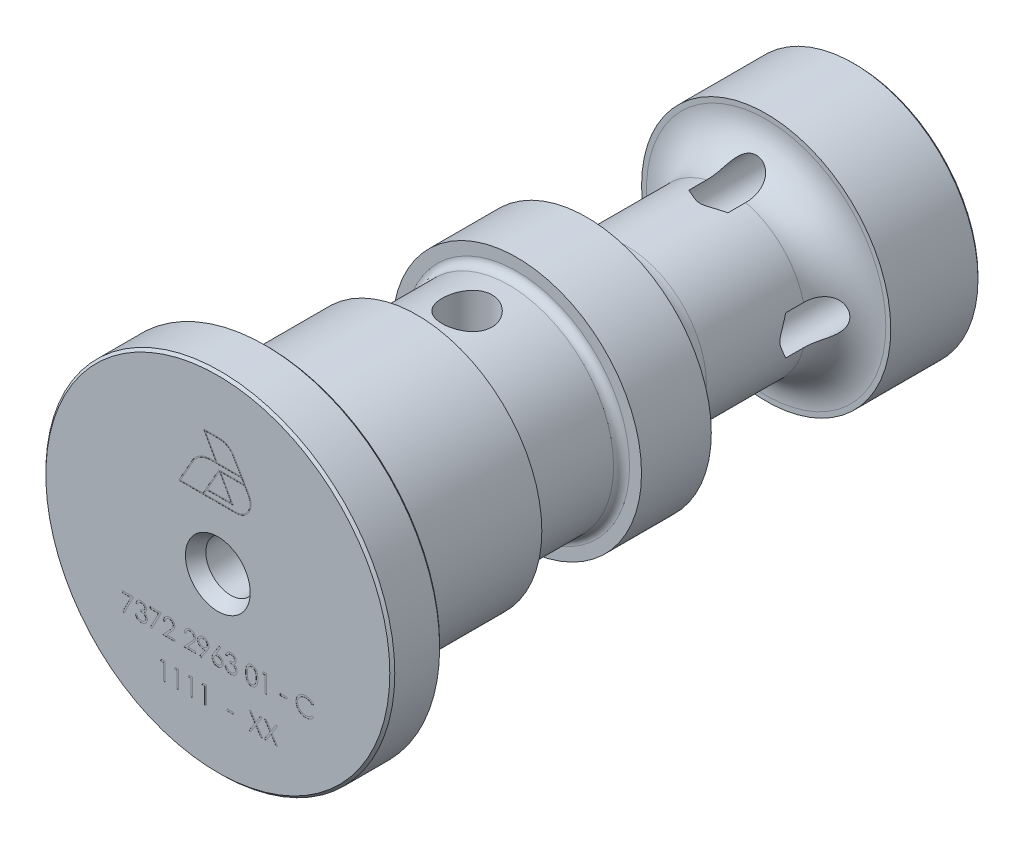
from build123d import *

# Parameters (mm, degrees)
CIRPATTERN1_COUNT       = 4
CUT_EXTRUDE2_DEPTH      = 69.618510622
CUT_EXTRUDE2_DEPTH_BACK = 69.618510622
SKETCH4_R               = 2.5
SKETCH5_W               = 0.692307692
SKETCH5_H               = 0.184615385
CUT_EXTRUDE3_DEPTH      = 0.01


with BuildPart() as part:
    # Sketch1 → Revolve1 (revolve)
    with BuildSketch(Plane(origin=(0, 0, 0), x_dir=(0, 0, -1), z_dir=(1, 0, 0))):
        with BuildLine():
            Line((0, 3.25), (0, 17.25))
            Line((0, 17.25), (0.25, 17.5))
            Line((0.25, 17.5), (4.75, 17.5))
            Line((4.75, 17.5), (5, 17.25))
            Line((5, 17.25), (5, 14.4975))
            ThreePointArc((5, 14.4975), (5.585786438, 13.083286438), (7, 12.4975))
            Line((7, 12.4975), (20, 12.4975))
            Line((20, 12.4975), (20, 11.3))
            ThreePointArc((20, 11.3), (20.234314575, 10.734314575), (20.8, 10.5))
            Line((20.8, 10.5), (29.2, 10.5))
            ThreePointArc((29.2, 10.5), (29.765685425, 10.734314575), (30, 11.3))
            Line((30, 11.3), (30, 12.4975))
            Line((30, 12.4975), (37, 12.4975))
            Line((37, 12.4975), (37, 12))
            ThreePointArc((37, 12), (38.171572875, 9.171572875), (41, 8))
            Line((41, 8), (51, 8))
            ThreePointArc((51, 8), (53.828427125, 9.171572875), (55, 12))
            Line((55, 12), (55, 12.4975))
            Line((55, 12.4975), (63.75, 12.4975))
            Line((63.75, 12.4975), (64, 12.2475))
            Line((64, 12.2475), (64, 10))
            Line((64, 10), (63.5, 9.5))
            Line((63.5, 9.5), (60.25, 9.5))
            ThreePointArc((60.25, 9.5), (59.366116524, 9.133883476), (59, 8.25))
            Line((59, 8.25), (59, 4.25))
            Line((59, 4.25), (57.718282402, 3.51))
            Line((57.718282402, 3.51), (33, 3.51))
            Line((33, 3.51), (33, 3.4))
            Line((33, 3.4), (22.042926105, 3.4))
            Line((22.042926105, 3.4), (20, 0))
            Line((20, 0), (11, 0))
            Line((11, 0), (9.497848452, 2.5))
            Line((9.497848452, 2.5), (1.299038106, 2.5))
            Line((1.299038106, 2.5), (0, 3.25))
        make_face()
    revolve(axis=Axis((0, 0, 67.498669623), (0, 0, -1)))

    # Sketch3 → Cut-Revolve3 (revolve, cut)
    with BuildSketch(Plane(origin=(0, 0, 0), x_dir=(0, 0, -1), z_dir=(1, 0, 0))):
        Polygon((66.818419238, -7.375), (66.818419238, -9.375), (49.201721238, -9.375), (48, -7.375), align=None)
    cut_revolve3 = revolve(axis=Axis((0, -7.375, -68.053965544), (0, 0, 1)), mode=Mode.SUBTRACT)

    # CirPattern1: Cut-Revolve3 ×4 about axis
    cirpattern1_axis = Axis((0, 0, -67.2), (0, 0, 1))
    for i in range(1, CIRPATTERN1_COUNT):
        add(cut_revolve3.rotate(cirpattern1_axis, i * 360 / CIRPATTERN1_COUNT), mode=Mode.SUBTRACT)

    # Sketch4 → Cut-Extrude2 (cut, two sides: drawn at the far end of the back side and taken through both)
    with BuildSketch(Plane(origin=(0, 0, 0), x_dir=(1, 0, 0), z_dir=(0, 1, 0)).offset(-CUT_EXTRUDE2_DEPTH_BACK)):
        with Locations((0, 25)):
            Circle(SKETCH4_R)
    extrude(amount=CUT_EXTRUDE2_DEPTH + CUT_EXTRUDE2_DEPTH_BACK, mode=Mode.SUBTRACT)

    # Sketch5 → Cut-Extrude3 (cut)
    # profile 1 of 20: a face of its own
    with BuildSketch(Plane.XY):
        Polygon((-9.553846154, -6.221311831), (-8.446153846, -6.221311831), (-9.392307692, -8.067465677), (-9.531850962, -7.990662792), (-8.719831731, -6.405927215), (-9.553846154, -6.405927215), align=None)
    # profile 2 of 20: a face of its own
    with BuildSketch(Plane.XY):
        with BuildLine():
            Line((-8.053846154, -6.636696446), (-8.215384615, -6.636696446))
            add(Edge.make_bspline(
                [(-8.215384615, -6.636696446), (-8.211008275, -6.618576883), (-8.202452888, -6.583154619), (-8.184608421, -6.532545171), (-8.165168804, -6.484653074), (-8.141825836, -6.440375093), (-8.116364191, -6.398821372), (-8.087192506, -6.360934393), (-8.055656649, -6.325750583), (-8.020775246, -6.294526632), (-7.984194791, -6.266252371), (-7.945399844, -6.242145199), (-7.905170927, -6.221407063), (-7.863229316, -6.204322372), (-7.819450142, -6.191452103), (-7.774229193, -6.182114317), (-7.727447964, -6.176050316), (-7.695692061, -6.175458495), (-7.679567308, -6.175157985)],
                knots=[0, 0, 0, 0, 1.162005537, 2.271625781, 3.343758855, 4.383309926, 5.390229558, 6.379919256, 7.361854164, 8.333198761, 9.295911338, 10.242430842, 11.177959212, 12.116337295, 13.062827104, 14.020064771, 14.994644689, 16, 16, 16, 16], degree=3))
            add(Edge.make_bspline(
                [(-7.679567308, -6.175157985), (-7.656073326, -6.175867303), (-7.609597835, -6.177270468), (-7.541319696, -6.190083606), (-7.475477332, -6.210359389), (-7.412791433, -6.238374448), (-7.354564811, -6.272927924), (-7.302757629, -6.314052646), (-7.258072109, -6.360955143), (-7.220583572, -6.412760462), (-7.191230715, -6.468126153), (-7.169586295, -6.525109091), (-7.15640943, -6.583574105), (-7.154701715, -6.623049277), (-7.153846154, -6.642826254)],
                knots=[0, 0, 0, 0, 1.083050992, 2.142477498, 3.193116406, 4.255571735, 5.30263384, 6.308962982, 7.297363603, 8.282367274, 9.249857812, 10.179914175, 11.08814088, 12, 12, 12, 12], degree=3))
            add(Edge.make_bspline(
                [(-7.153846154, -6.642826254), (-7.154444572, -6.66185832), (-7.155615584, -6.699101119), (-7.165558632, -6.753472175), (-7.182291568, -6.804716426), (-7.205470303, -6.853049596), (-7.235474528, -6.898165227), (-7.271820487, -6.940164828), (-7.314764713, -6.979234681), (-7.347308167, -7.001616124), (-7.3640625, -7.013138754)],
                knots=[0, 0, 0, 0, 1.024540389, 2.004866551, 2.965041327, 3.920577974, 4.882998113, 5.874504559, 6.905732034, 8, 8, 8, 8], degree=3))
            add(Edge.make_bspline(
                [(-7.3640625, -7.013138754), (-7.344914741, -7.022384671), (-7.306977491, -7.040703506), (-7.25526579, -7.076629324), (-7.208322883, -7.118109731), (-7.182143827, -7.150480239), (-7.168990385, -7.166744523)],
                knots=[0, 0, 0, 0, 1.015518401, 2.012035669, 3.001164323, 4, 4, 4, 4], degree=3))
            add(Edge.make_bspline(
                [(-7.168990385, -7.166744523), (-7.160329123, -7.178602795), (-7.143148433, -7.202125152), (-7.121941588, -7.239943886), (-7.102702614, -7.278181795), (-7.087711073, -7.317863775), (-7.076101656, -7.358529896), (-7.067803125, -7.400249986), (-7.062647853, -7.443058111), (-7.061909569, -7.472018815), (-7.061538462, -7.486576254)],
                knots=[0, 0, 0, 0, 1.025084078, 2.033381695, 3.024893161, 4.013698104, 4.991890475, 5.976764909, 6.982997093, 8, 8, 8, 8], degree=3))
            add(Edge.make_bspline(
                [(-7.061538462, -7.486576254), (-7.062461354, -7.511781253), (-7.064302796, -7.562072637), (-7.080762035, -7.636373923), (-7.106277416, -7.709004181), (-7.142512411, -7.778471241), (-7.186672844, -7.843466866), (-7.239210897, -7.901620396), (-7.299529621, -7.95160825), (-7.366801098, -7.99337351), (-7.439684192, -8.02675987), (-7.517637354, -8.049932269), (-7.599537382, -8.065024497), (-7.655701135, -8.066642887), (-7.684254808, -8.067465677)],
                knots=[0, 0, 0, 0, 0.955779014, 1.907060117, 2.875433937, 3.871313158, 4.872415639, 5.851225146, 6.836215519, 7.83643374, 8.849228613, 9.86973379, 10.916971861, 12, 12, 12, 12], degree=3))
            add(Edge.make_bspline(
                [(-7.684254808, -8.067465677), (-7.703499019, -8.067019167), (-7.74136521, -8.066140585), (-7.797033295, -8.060134447), (-7.850170169, -8.04916473), (-7.900847677, -8.034403031), (-7.949110838, -8.015687277), (-7.994812378, -7.992380518), (-8.038233466, -7.964963175), (-8.078964355, -7.933111615), (-8.11700019, -7.897481212), (-8.151330163, -7.857439435), (-8.182526628, -7.813726485), (-8.20975427, -7.765834627), (-8.234253275, -7.714382781), (-8.254403481, -7.658712124), (-8.272138916, -7.599320342), (-8.280384698, -7.557931789), (-8.284615385, -7.536696446)],
                knots=[0, 0, 0, 0, 1.048658725, 2.063410685, 3.046034179, 4.001477787, 4.936774919, 5.862367409, 6.792675028, 7.730719943, 8.675894397, 9.627829632, 10.600096036, 11.597688215, 12.626045268, 13.701542398, 14.82072376, 16, 16, 16, 16], degree=3))
            Line((-8.284615385, -7.536696446), (-8.123076923, -7.536696446))
            add(Edge.make_bspline(
                [(-8.123076923, -7.536696446), (-8.118868373, -7.550555939), (-8.110682378, -7.577513856), (-8.096748168, -7.616311727), (-8.080873056, -7.651878726), (-8.063842712, -7.68447576), (-8.045956654, -7.714423853), (-8.025943264, -7.7409311), (-8.005284846, -7.765161775), (-7.989712608, -7.77881329), (-7.982091346, -7.785494523)],
                knots=[0, 0, 0, 0, 1.198163088, 2.33053128, 3.407730985, 4.417276592, 5.372219308, 6.28897303, 7.162600585, 8, 8, 8, 8], degree=3))
            add(Edge.make_bspline(
                [(-7.982091346, -7.785494523), (-7.972013107, -7.793264523), (-7.951887737, -7.80878054), (-7.919092647, -7.828581377), (-7.884602134, -7.845738476), (-7.847668873, -7.858844377), (-7.809089848, -7.869941459), (-7.768241489, -7.877203441), (-7.725484177, -7.882185929), (-7.696289328, -7.882625608), (-7.681370192, -7.882850292)],
                knots=[0, 0, 0, 0, 0.946170439, 1.889420265, 2.845303464, 3.807233317, 4.801018734, 5.828864929, 6.890507805, 8, 8, 8, 8], degree=3))
            add(Edge.make_bspline(
                [(-7.681370192, -7.882850292), (-7.664525534, -7.882533541), (-7.631587258, -7.881914161), (-7.583524759, -7.876218084), (-7.537800929, -7.867922442), (-7.494923424, -7.855110051), (-7.454330592, -7.839279899), (-7.416591458, -7.819403576), (-7.381210603, -7.796083434), (-7.348641195, -7.769577581), (-7.319354934, -7.740560812), (-7.293568898, -7.710211232), (-7.271647644, -7.678656806), (-7.253964661, -7.645722915), (-7.240001521, -7.61154594), (-7.230495875, -7.576029971), (-7.223886524, -7.539465662), (-7.223348266, -7.514610764), (-7.223076923, -7.502081062)],
                knots=[0, 0, 0, 0, 1.217147791, 2.380027433, 3.494444702, 4.572153297, 5.609568379, 6.639424714, 7.649109417, 8.668170816, 9.669597737, 10.625200337, 11.543417969, 12.441394052, 13.322311151, 14.205496177, 15.095365482, 16, 16, 16, 16], degree=3))
            add(Edge.make_bspline(
                [(-7.223076923, -7.502081062), (-7.223863935, -7.485309516), (-7.225434044, -7.451849877), (-7.237421313, -7.402623696), (-7.257138443, -7.355194513), (-7.284741449, -7.310371535), (-7.318342681, -7.268829643), (-7.357616062, -7.231764309), (-7.402887722, -7.201179691), (-7.444555083, -7.180048382), (-7.481462878, -7.165629314), (-7.513047933, -7.156025047), (-7.548408472, -7.14789231), (-7.58711688, -7.140325999), (-7.62946482, -7.133886448), (-7.675406188, -7.128516372), (-7.724950294, -7.124219493), (-7.759248607, -7.122300644), (-7.776923077, -7.121311831)],
                knots=[0, 0, 0, 0, 1.07054697, 2.135767047, 3.216561865, 4.33974944, 5.486079747, 6.621378074, 7.775625952, 8.963672916, 9.598146892, 10.304877434, 11.070270905, 11.915000392, 12.823868403, 13.805723172, 14.86925407, 16, 16, 16, 16], degree=3))
            Line((-7.776923077, -7.121311831), (-7.776923077, -6.936696446))
            add(Edge.make_bspline(
                [(-7.776923077, -6.936696446), (-7.754653906, -6.936318547), (-7.711034071, -6.935578336), (-7.647317, -6.926625645), (-7.586387868, -6.914241322), (-7.529596972, -6.895271794), (-7.477834776, -6.873239642), (-7.432927552, -6.847601362), (-7.395504448, -6.819102348), (-7.365747326, -6.787302721), (-7.343360865, -6.753197839), (-7.326992798, -6.71765213), (-7.317324059, -6.680354041), (-7.316033373, -6.65489964), (-7.315384615, -6.6421051)],
                knots=[0, 0, 0, 0, 1.321986639, 2.589447074, 3.816329219, 5.01088745, 6.139805852, 7.153945165, 8.075214402, 8.924034688, 9.728124013, 10.488707548, 11.240355623, 12, 12, 12, 12], degree=3))
            add(Edge.make_bspline(
                [(-7.315384615, -6.6421051), (-7.315597741, -6.632705117), (-7.316021744, -6.614004296), (-7.321368916, -6.586682832), (-7.329404137, -6.560196631), (-7.340450855, -6.534658329), (-7.355236671, -6.510245045), (-7.372931179, -6.486748643), (-7.394000487, -6.464303271), (-7.41814386, -6.443381964), (-7.444069931, -6.423443499), (-7.472484101, -6.406516486), (-7.502529637, -6.392041882), (-7.534239802, -6.380105567), (-7.567717503, -6.371126504), (-7.602805447, -6.3646795), (-7.639570542, -6.360648706), (-7.664653147, -6.360068378), (-7.677403846, -6.359773369)],
                knots=[0, 0, 0, 0, 0.884392785, 1.759457502, 2.611959086, 3.489218968, 4.37281399, 5.2945488, 6.255912374, 7.266815255, 8.301784654, 9.332968512, 10.37626691, 11.440494194, 12.520033166, 13.637162961, 14.798855837, 16, 16, 16, 16], degree=3))
            add(Edge.make_bspline(
                [(-7.677403846, -6.359773369), (-7.69789899, -6.360488927), (-7.737930772, -6.361886577), (-7.795641301, -6.374128127), (-7.849291244, -6.393659713), (-7.890299701, -6.416973837), (-7.920582168, -6.439988346), (-7.942221736, -6.460087859), (-7.963472284, -6.48242474), (-7.982935775, -6.508374761), (-8.002619534, -6.536180539), (-8.020539595, -6.567255575), (-8.037953151, -6.600789264), (-8.04844589, -6.62449559), (-8.053846154, -6.636696446)],
                knots=[0, 0, 0, 0, 1.472543308, 2.876219568, 4.221790263, 5.565193594, 6.249813518, 6.953379497, 7.687249741, 8.463570142, 9.283606569, 10.136032583, 11.040678096, 12, 12, 12, 12], degree=3))
        make_face()
    # profile 3 of 20: a face of its own
    with BuildSketch(Plane.XY):
        Polygon((-6.784615385, -6.221311831), (-5.676923077, -6.221311831), (-6.623076923, -8.067465677), (-6.762620192, -7.990662792), (-5.950600962, -6.405927215), (-6.784615385, -6.405927215), align=None)
    # profile 4 of 20: a face of its own
    with BuildSketch(Plane.XY):
        with BuildLine():
            Line((-5.284615385, -6.775157985), (-5.446153846, -6.775157985))
            add(Edge.make_bspline(
                [(-5.446153846, -6.775157985), (-5.445101025, -6.753727242), (-5.443033311, -6.711637835), (-5.433350191, -6.650271254), (-5.419494883, -6.591614501), (-5.399904992, -6.536138545), (-5.375576049, -6.483352873), (-5.346400606, -6.43346715), (-5.311843769, -6.386671682), (-5.272651734, -6.343400277), (-5.230085006, -6.303703812), (-5.184156237, -6.269423973), (-5.13589308, -6.240460599), (-5.085441961, -6.216247389), (-5.032233671, -6.198072611), (-4.976751058, -6.184587196), (-4.918750359, -6.176473647), (-4.879232634, -6.175601529), (-4.859134615, -6.175157985)],
                knots=[0, 0, 0, 0, 1.10065271, 2.161652631, 3.183658789, 4.190468796, 5.17591951, 6.163126047, 7.15150782, 8.156236427, 9.156009102, 10.134482811, 11.092018607, 12.041330605, 13.001268258, 13.972401359, 14.968799086, 16, 16, 16, 16], degree=3))
            add(Edge.make_bspline(
                [(-4.859134615, -6.175157985), (-4.83939732, -6.175620048), (-4.80061424, -6.176527986), (-4.744010918, -6.184325087), (-4.690125453, -6.196537105), (-4.639063173, -6.213670748), (-4.591231482, -6.236702739), (-4.546271059, -6.264370045), (-4.503646642, -6.296368815), (-4.465277439, -6.334042205), (-4.430044713, -6.374260574), (-4.399649267, -6.41719721), (-4.373619641, -6.4615437), (-4.351923119, -6.507638204), (-4.335951391, -6.555914733), (-4.323825455, -6.605670437), (-4.316971357, -6.65742034), (-4.315919425, -6.692446568), (-4.315384615, -6.710254139)],
                knots=[0, 0, 0, 0, 1.111607364, 2.184268762, 3.212621178, 4.221274766, 5.211760367, 6.196651075, 7.1921475, 8.207485113, 9.220403448, 10.201281604, 11.166441695, 12.114753415, 13.065576456, 14.026450734, 14.996634279, 16, 16, 16, 16], degree=3))
            add(Edge.make_bspline(
                [(-4.315384615, -6.710254139), (-4.316252033, -6.735325469), (-4.317971646, -6.785028164), (-4.332811721, -6.858161833), (-4.355739657, -6.929084435), (-4.383548643, -6.986159376), (-4.411639221, -7.031918921), (-4.436417402, -7.06993268), (-4.466067183, -7.110471979), (-4.500317281, -7.153945121), (-4.53865101, -7.200485083), (-4.581344268, -7.250110963), (-4.628723194, -7.302295691), (-4.661975974, -7.337938681), (-4.679206731, -7.356407985)],
                knots=[0, 0, 0, 0, 1.184203166, 2.347625244, 3.513805382, 4.700623107, 5.337941753, 6.051866363, 6.845199593, 7.711357327, 8.668078039, 9.695487809, 10.805859518, 12, 12, 12, 12], degree=3))
            Line((-4.679206731, -7.356407985), (-5.129567308, -7.836696446))
            Line((-5.129567308, -7.836696446), (-4.292307692, -7.836696446))
            Line((-4.292307692, -7.836696446), (-4.292307692, -8.021311831))
            Line((-4.292307692, -8.021311831), (-5.515384615, -8.021311831))
            Line((-5.515384615, -8.021311831), (-4.817307692, -7.276359908))
            add(Edge.make_bspline(
                [(-4.817307692, -7.276359908), (-4.800311636, -7.258617922), (-4.767665691, -7.224539197), (-4.721491794, -7.174785675), (-4.680020315, -7.128628768), (-4.642982798, -7.086155686), (-4.61118271, -7.046745165), (-4.582962705, -7.011673603), (-4.560351829, -6.979399886), (-4.535812483, -6.941990428), (-4.512045293, -6.896315522), (-4.491621795, -6.840498196), (-4.479168445, -6.783038466), (-4.477674529, -6.744208847), (-4.476923077, -6.724677215)],
                knots=[0, 0, 0, 0, 1.329631726, 2.553950428, 3.673215718, 4.687767853, 5.603093632, 6.413772471, 7.123043292, 7.734684054, 8.834405432, 9.900288307, 10.943827018, 12, 12, 12, 12], degree=3))
            add(Edge.make_bspline(
                [(-4.476923077, -6.724677215), (-4.47725003, -6.712395353), (-4.477894392, -6.688190162), (-4.483581208, -6.652701486), (-4.492175182, -6.618468153), (-4.504489887, -6.585384863), (-4.520744782, -6.553784242), (-4.540531091, -6.523627824), (-4.563360267, -6.494473499), (-4.589769491, -6.467137517), (-4.61878113, -6.442101468), (-4.649429601, -6.419923367), (-4.681855369, -6.401388967), (-4.715921717, -6.386195169), (-4.751533673, -6.374276401), (-4.788760113, -6.366017703), (-4.827498179, -6.360832426), (-4.853949691, -6.360130852), (-4.867427885, -6.359773369)],
                knots=[0, 0, 0, 0, 0.991446411, 1.95395049, 2.89581595, 3.838931463, 4.798493298, 5.75982156, 6.748411868, 7.785213223, 8.824556874, 9.840280684, 10.836137867, 11.835679398, 12.848801643, 13.863922112, 14.911575587, 16, 16, 16, 16], degree=3))
            add(Edge.make_bspline(
                [(-4.867427885, -6.359773369), (-4.881504313, -6.3601411), (-4.909148094, -6.360863263), (-4.949735025, -6.365914919), (-4.988453425, -6.374629922), (-5.025400689, -6.386549355), (-5.060639333, -6.401699466), (-5.093997985, -6.420569506), (-5.125401756, -6.443086731), (-5.154909683, -6.46861616), (-5.182096872, -6.497039498), (-5.205983836, -6.528724621), (-5.226855615, -6.563093006), (-5.245066078, -6.600051918), (-5.259854719, -6.639936719), (-5.271155196, -6.682605825), (-5.280097003, -6.727873964), (-5.283084242, -6.759134864), (-5.284615385, -6.775157985)],
                knots=[0, 0, 0, 0, 1.031018746, 2.02475058, 2.990194455, 3.934040569, 4.864654155, 5.795059489, 6.735614925, 7.690564532, 8.649604399, 9.611025574, 10.590972636, 11.591080095, 12.624614302, 13.701020113, 14.821632451, 16, 16, 16, 16], degree=3))
        make_face()
    # profile 5 of 20: a face of its own
    with BuildSketch(Plane.XY):
        with BuildLine():
            Line((-3.207692308, -6.775157985), (-3.369230769, -6.775157985))
            add(Edge.make_bspline(
                [(-3.369230769, -6.775157985), (-3.368177948, -6.753727242), (-3.366110234, -6.711637835), (-3.356427114, -6.650271254), (-3.342571806, -6.591614501), (-3.322981915, -6.536138545), (-3.298652972, -6.483352873), (-3.26947753, -6.43346715), (-3.234920692, -6.386671682), (-3.195728658, -6.343400277), (-3.153161929, -6.303703812), (-3.10723316, -6.269423973), (-3.058970003, -6.240460599), (-3.008518884, -6.216247389), (-2.955310594, -6.198072611), (-2.899827981, -6.184587196), (-2.841827282, -6.176473647), (-2.802309557, -6.175601529), (-2.782211538, -6.175157985)],
                knots=[0, 0, 0, 0, 1.10065271, 2.161652631, 3.183658789, 4.190468796, 5.17591951, 6.163126047, 7.15150782, 8.156236427, 9.156009102, 10.134482811, 11.092018607, 12.041330605, 13.001268258, 13.972401359, 14.968799086, 16, 16, 16, 16], degree=3))
            add(Edge.make_bspline(
                [(-2.782211538, -6.175157985), (-2.762474243, -6.175620048), (-2.723691163, -6.176527986), (-2.667087841, -6.184325087), (-2.613202376, -6.196537105), (-2.562140096, -6.213670748), (-2.514308405, -6.236702739), (-2.469347982, -6.264370045), (-2.426723565, -6.296368815), (-2.388354362, -6.334042205), (-2.353121636, -6.374260574), (-2.322726191, -6.41719721), (-2.296696564, -6.4615437), (-2.275000043, -6.507638204), (-2.259028314, -6.555914733), (-2.246902378, -6.605670437), (-2.24004828, -6.65742034), (-2.238996348, -6.692446568), (-2.238461538, -6.710254139)],
                knots=[0, 0, 0, 0, 1.111607364, 2.184268762, 3.212621178, 4.221274766, 5.211760367, 6.196651075, 7.1921475, 8.207485113, 9.220403448, 10.201281604, 11.166441695, 12.114753415, 13.065576456, 14.026450734, 14.996634279, 16, 16, 16, 16], degree=3))
            add(Edge.make_bspline(
                [(-2.238461538, -6.710254139), (-2.239328956, -6.735325469), (-2.241048569, -6.785028164), (-2.255888644, -6.858161833), (-2.27881658, -6.929084435), (-2.306625566, -6.986159376), (-2.334716144, -7.031918921), (-2.359494325, -7.06993268), (-2.389144106, -7.110471979), (-2.423394204, -7.153945121), (-2.461727933, -7.200485083), (-2.504421191, -7.250110963), (-2.551800118, -7.302295691), (-2.585052897, -7.337938681), (-2.602283654, -7.356407985)],
                knots=[0, 0, 0, 0, 1.184203166, 2.347625244, 3.513805382, 4.700623107, 5.337941753, 6.051866363, 6.845199593, 7.711357327, 8.668078039, 9.695487809, 10.805859518, 12, 12, 12, 12], degree=3))
            Line((-2.602283654, -7.356407985), (-3.052644231, -7.836696446))
            Line((-3.052644231, -7.836696446), (-2.215384615, -7.836696446))
            Line((-2.215384615, -7.836696446), (-2.215384615, -8.021311831))
            Line((-2.215384615, -8.021311831), (-3.438461538, -8.021311831))
            Line((-3.438461538, -8.021311831), (-2.740384615, -7.276359908))
            add(Edge.make_bspline(
                [(-2.740384615, -7.276359908), (-2.723388559, -7.258617922), (-2.690742614, -7.224539197), (-2.644568717, -7.174785675), (-2.603097238, -7.128628768), (-2.566059721, -7.086155686), (-2.534259633, -7.046745165), (-2.506039628, -7.011673603), (-2.483428752, -6.979399886), (-2.458889406, -6.941990428), (-2.435122216, -6.896315522), (-2.414698718, -6.840498196), (-2.402245368, -6.783038466), (-2.400751452, -6.744208847), (-2.4, -6.724677215)],
                knots=[0, 0, 0, 0, 1.329631726, 2.553950428, 3.673215718, 4.687767853, 5.603093632, 6.413772471, 7.123043292, 7.734684054, 8.834405432, 9.900288307, 10.943827018, 12, 12, 12, 12], degree=3))
            add(Edge.make_bspline(
                [(-2.4, -6.724677215), (-2.400326953, -6.712395353), (-2.400971315, -6.688190162), (-2.406658131, -6.652701486), (-2.415252106, -6.618468153), (-2.42756681, -6.585384863), (-2.443821705, -6.553784242), (-2.463608014, -6.523627824), (-2.48643719, -6.494473499), (-2.512846414, -6.467137517), (-2.541858053, -6.442101468), (-2.572506524, -6.419923367), (-2.604932292, -6.401388967), (-2.63899864, -6.386195169), (-2.674610596, -6.374276401), (-2.711837036, -6.366017703), (-2.750575102, -6.360832426), (-2.777026614, -6.360130852), (-2.790504808, -6.359773369)],
                knots=[0, 0, 0, 0, 0.991446411, 1.95395049, 2.89581595, 3.838931463, 4.798493298, 5.75982156, 6.748411868, 7.785213223, 8.824556874, 9.840280684, 10.836137867, 11.835679398, 12.848801643, 13.863922112, 14.911575587, 16, 16, 16, 16], degree=3))
            add(Edge.make_bspline(
                [(-2.790504808, -6.359773369), (-2.804581236, -6.3601411), (-2.832225017, -6.360863263), (-2.872811948, -6.365914919), (-2.911530348, -6.374629922), (-2.948477612, -6.386549355), (-2.983716256, -6.401699466), (-3.017074908, -6.420569506), (-3.048478679, -6.443086731), (-3.077986606, -6.46861616), (-3.105173795, -6.497039498), (-3.12906076, -6.528724621), (-3.149932538, -6.563093006), (-3.168143001, -6.600051918), (-3.182931642, -6.639936719), (-3.194232119, -6.682605825), (-3.203173926, -6.727873964), (-3.206161165, -6.759134864), (-3.207692308, -6.775157985)],
                knots=[0, 0, 0, 0, 1.031018746, 2.02475058, 2.990194455, 3.934040569, 4.864654155, 5.795059489, 6.735614925, 7.690564532, 8.649604399, 9.611025574, 10.590972636, 11.591080095, 12.624614302, 13.701020113, 14.821632451, 16, 16, 16, 16], degree=3))
        make_face()
    # profile 6 of 20: a face of its own
    with BuildSketch(Plane.XY):
        with BuildLine():
            Line((-1.661538462, -8.067465677), (-1.790625, -7.977682023))
            Line((-1.790625, -7.977682023), (-1.290144231, -7.246071446))
            add(Edge.make_bspline(
                [(-1.290144231, -7.246071446), (-1.322076609, -7.24997645), (-1.384953242, -7.257665621), (-1.448280895, -7.259078186), (-1.479447115, -7.259773369)],
                knots=[0, 0, 0, 0, 1.015715272, 2, 2, 2, 2], degree=3))
            add(Edge.make_bspline(
                [(-1.479447115, -7.259773369), (-1.498343026, -7.259289387), (-1.535434045, -7.258339372), (-1.589964609, -7.2508093), (-1.642362898, -7.239212091), (-1.692489995, -7.221907017), (-1.740534312, -7.200400509), (-1.786390964, -7.173731188), (-1.829998222, -7.142356524), (-1.870887747, -7.106442414), (-1.908076642, -7.067007987), (-1.941208623, -7.025270799), (-1.968744063, -6.980746014), (-1.991617735, -6.934341901), (-2.008964826, -6.885391492), (-2.021596988, -6.834451801), (-2.029374199, -6.781165814), (-2.030299448, -6.744895746), (-2.030769231, -6.7264801)],
                knots=[0, 0, 0, 0, 1.060718605, 2.082097864, 3.085795603, 4.069760067, 5.054557537, 6.03741023, 7.043284206, 8.066802108, 9.088538119, 10.083643548, 11.053783639, 12.022749082, 12.983451788, 13.964007469, 14.966251758, 16, 16, 16, 16], degree=3))
            add(Edge.make_bspline(
                [(-2.030769231, -6.7264801), (-2.029877236, -6.701296222), (-2.02812643, -6.651865377), (-2.014035764, -6.579642296), (-1.990861876, -6.511352073), (-1.958550139, -6.447174259), (-1.917852282, -6.38803205), (-1.868939293, -6.334747623), (-1.812108683, -6.288078841), (-1.748655073, -6.247962458), (-1.68007352, -6.215698745), (-1.608243924, -6.191918534), (-1.533716662, -6.177930606), (-1.483230432, -6.176086449), (-1.4578125, -6.175157985)],
                knots=[0, 0, 0, 0, 1.022988612, 2.007919123, 2.978103895, 3.94594894, 4.918897164, 5.887013414, 6.875921846, 7.89917871, 8.930658928, 9.948724884, 10.967259574, 12, 12, 12, 12], degree=3))
            add(Edge.make_bspline(
                [(-1.4578125, -6.175157985), (-1.432875598, -6.176099211), (-1.383602632, -6.177958987), (-1.311145428, -6.191579314), (-1.241747191, -6.214535317), (-1.175792626, -6.246258807), (-1.114726643, -6.286023845), (-1.059813369, -6.333407314), (-1.012305948, -6.388438728), (-0.972282238, -6.449787095), (-0.940154789, -6.515701542), (-0.916974758, -6.584504702), (-0.902705572, -6.655701759), (-0.900907461, -6.703938917), (-0.9, -6.728282985)],
                knots=[0, 0, 0, 0, 1.026385292, 2.028040595, 3.023318987, 4.028184125, 5.03290303, 6.015178782, 7.004435299, 8.016004309, 9.023023918, 10.015172535, 10.998308025, 12, 12, 12, 12], degree=3))
            add(Edge.make_bspline(
                [(-0.9, -6.728282985), (-0.900606039, -6.747179779), (-0.901835237, -6.7855072), (-0.910442481, -6.843739948), (-0.925058576, -6.903114866), (-0.941645164, -6.953371687), (-0.957655993, -6.994878889), (-0.972725146, -7.027665416), (-0.989445683, -7.062174637), (-1.008946762, -7.098044697), (-1.029910229, -7.135732858), (-1.053597857, -7.174861111), (-1.079469294, -7.215481965), (-1.097896007, -7.242866182), (-1.107331731, -7.256888754)],
                knots=[0, 0, 0, 0, 1.179839688, 2.393009684, 3.667231171, 4.993948276, 5.694988576, 6.444077775, 7.246288328, 8.089075292, 8.993003841, 9.939041771, 10.944649915, 12, 12, 12, 12], degree=3))
            Line((-1.107331731, -7.256888754), (-1.661538462, -8.067465677))
        make_face()
        with BuildLine():
            add(Edge.make_bspline(
                [(-1.449519231, -7.075157985), (-1.435204595, -7.07476693), (-1.407338865, -7.07400568), (-1.366516254, -7.069372356), (-1.327983807, -7.061157163), (-1.291638593, -7.049369882), (-1.257116186, -7.035146453), (-1.224964932, -7.017037431), (-1.195157922, -6.995428876), (-1.167495559, -6.971149439), (-1.142931217, -6.944174854), (-1.121051944, -6.915942056), (-1.10245508, -6.886327114), (-1.087765395, -6.85495915), (-1.075687613, -6.822601729), (-1.067346921, -6.788733774), (-1.062726407, -6.75353174), (-1.06193874, -6.729618144), (-1.061538462, -6.717465677)],
                knots=[0, 0, 0, 0, 1.163407946, 2.26475976, 3.333800367, 4.359385343, 5.366239384, 6.363380779, 7.350133999, 8.353570782, 9.349036268, 10.310270964, 11.253520213, 12.184142, 13.120487599, 14.056272588, 15.012232024, 16, 16, 16, 16], degree=3))
            add(Edge.make_bspline(
                [(-1.061538462, -6.717465677), (-1.061882863, -6.705308135), (-1.062561548, -6.681350207), (-1.068006445, -6.646096055), (-1.077585131, -6.612310949), (-1.09043738, -6.579809928), (-1.107367788, -6.548860023), (-1.127683867, -6.51907266), (-1.151820555, -6.490636709), (-1.179593303, -6.464220946), (-1.209542502, -6.439870598), (-1.241459331, -6.418380616), (-1.275080716, -6.400369715), (-1.31020154, -6.385507387), (-1.346894976, -6.373909331), (-1.385139313, -6.365568972), (-1.425127807, -6.360954927), (-1.452272469, -6.360172238), (-1.466105769, -6.359773369)],
                knots=[0, 0, 0, 0, 0.972161553, 1.915763587, 2.844109794, 3.775983486, 4.705125789, 5.659731448, 6.655561913, 7.682237399, 8.721216875, 9.739758359, 10.754845918, 11.767244016, 12.7857855, 13.828538656, 14.893392813, 16, 16, 16, 16], degree=3))
            add(Edge.make_bspline(
                [(-1.466105769, -6.359773369), (-1.479818762, -6.360172883), (-1.506723542, -6.360956725), (-1.546356538, -6.365560202), (-1.584342282, -6.373965422), (-1.620929401, -6.385502015), (-1.656049181, -6.400370823), (-1.68966898, -6.418381559), (-1.721593275, -6.439865651), (-1.751513759, -6.464240105), (-1.779335548, -6.490513752), (-1.803057249, -6.519197229), (-1.823419822, -6.548844528), (-1.840326966, -6.579814046), (-1.853185403, -6.61230985), (-1.862762433, -6.646096353), (-1.868207775, -6.681350129), (-1.868886399, -6.705308109), (-1.869230769, -6.717465677)],
                knots=[0, 0, 0, 0, 1.099389452, 2.15699305, 3.192601482, 4.213358962, 5.227959689, 6.245255729, 7.266013209, 8.307253147, 9.336162325, 10.327954924, 11.284637477, 12.215801273, 13.149702402, 14.080068371, 15.025723358, 16, 16, 16, 16], degree=3))
            add(Edge.make_bspline(
                [(-1.869230769, -6.717465677), (-1.86891915, -6.729627608), (-1.86830458, -6.753613161), (-1.862376003, -6.788855306), (-1.852461459, -6.822637806), (-1.839182915, -6.855289141), (-1.821696383, -6.886491811), (-1.800238404, -6.916097883), (-1.77508698, -6.944442971), (-1.746578329, -6.97108668), (-1.715377561, -6.995542085), (-1.68205352, -7.016900567), (-1.64717989, -7.034937824), (-1.610633908, -7.049410536), (-1.572686411, -7.061039391), (-1.532996343, -7.069357215), (-1.491694964, -7.073961238), (-1.463712688, -7.074755242), (-1.449519231, -7.075157985)],
                knots=[0, 0, 0, 0, 0.952633368, 1.87876736, 2.791047057, 3.707742249, 4.635551637, 5.587206343, 6.568248508, 7.601284464, 8.641511608, 9.671105535, 10.699146789, 11.713763218, 12.747829548, 13.806491675, 14.887386225, 16, 16, 16, 16], degree=3))
        make_face(mode=Mode.SUBTRACT)
    # profile 7 of 20: a face of its own
    with BuildSketch(Plane.XY):
        with BuildLine():
            Line((0.161538462, -6.175157985), (0.286298077, -6.272874331))
            Line((0.286298077, -6.272874331), (-0.189302885, -7.000157985))
            add(Edge.make_bspline(
                [(-0.189302885, -7.000157985), (-0.157638171, -6.995110856), (-0.095872566, -6.985265862), (-0.033352961, -6.983641776), (-0.002884615, -6.982850292)],
                knots=[0, 0, 0, 0, 1.025318673, 2, 2, 2, 2], degree=3))
            add(Edge.make_bspline(
                [(-0.002884615, -6.982850292), (0.015410732, -6.983334885), (0.051305462, -6.984285637), (0.104047742, -6.991799135), (0.154739545, -7.003493854), (0.203267782, -7.020609785), (0.249694045, -7.042466944), (0.294283806, -7.068664401), (0.336199137, -7.100552948), (0.37597974, -7.13617495), (0.412096534, -7.175629393), (0.444072791, -7.217492939), (0.470932284, -7.261721963), (0.492724586, -7.308294065), (0.509647095, -7.357137456), (0.521983599, -7.408189642), (0.529275961, -7.461485827), (0.530266213, -7.497731746), (0.530769231, -7.516143562)],
                knots=[0, 0, 0, 0, 1.044136307, 2.048553127, 3.035567123, 4.010001674, 4.980053131, 5.96154148, 6.956538004, 7.981742224, 9.006487041, 10.005615874, 10.984750588, 11.954802044, 12.935714515, 13.930994945, 14.949008866, 16, 16, 16, 16], degree=3))
            add(Edge.make_bspline(
                [(0.530769231, -7.516143562), (0.530037348, -7.541333124), (0.528597177, -7.59090022), (0.514246653, -7.663093955), (0.491947407, -7.731870677), (0.46007325, -7.796132308), (0.42048231, -7.855790773), (0.372202405, -7.908651869), (0.316945754, -7.95579646), (0.254466829, -7.995219864), (0.18722759, -8.027415719), (0.11658942, -8.0505407), (0.043238317, -8.064777913), (-0.00654691, -8.066562795), (-0.031730769, -8.067465677)],
                knots=[0, 0, 0, 0, 1.031375318, 2.029502543, 3.004789286, 3.987476834, 4.960371455, 5.9300674, 6.912260825, 7.929083631, 8.949397511, 9.960523116, 10.96833055, 12, 12, 12, 12], degree=3))
            add(Edge.make_bspline(
                [(-0.031730769, -8.067465677), (-0.05595193, -8.066679743), (-0.103929807, -8.065122944), (-0.174506673, -8.051254748), (-0.242321939, -8.028776809), (-0.306900478, -7.997809466), (-0.366722507, -7.958693983), (-0.420241977, -7.911604811), (-0.467192033, -7.857548515), (-0.506264695, -7.796533479), (-0.5372549, -7.730967215), (-0.560495433, -7.662599535), (-0.574070644, -7.591679544), (-0.575967616, -7.54360353), (-0.576923077, -7.519388754)],
                knots=[0, 0, 0, 0, 1.012016664, 2.004627821, 2.994792927, 3.992885782, 4.990978636, 5.973936114, 6.964471063, 7.975201453, 8.993600317, 9.990122807, 10.98767138, 12, 12, 12, 12], degree=3))
            add(Edge.make_bspline(
                [(-0.576923077, -7.519388754), (-0.576315477, -7.50085154), (-0.575074873, -7.46300209), (-0.566412558, -7.405677733), (-0.552493521, -7.347022891), (-0.536905394, -7.297263591), (-0.52043508, -7.256500523), (-0.50672806, -7.223635871), (-0.489667148, -7.18981589), (-0.471475123, -7.153880877), (-0.450514447, -7.11675694), (-0.427723542, -7.077823625), (-0.402472293, -7.037700119), (-0.384770495, -7.010471676), (-0.375721154, -6.996552215)],
                knots=[0, 0, 0, 0, 1.173818275, 2.396712641, 3.66331629, 4.989737886, 5.693666774, 6.447286557, 7.243889047, 8.091586357, 8.998013824, 9.943181721, 10.948533338, 12, 12, 12, 12], degree=3))
            Line((-0.375721154, -6.996552215), (0.161538462, -6.175157985))
        make_face()
        with BuildLine():
            add(Edge.make_bspline(
                [(-0.036778846, -7.167465677), (-0.050490419, -7.167871124), (-0.077392413, -7.168666606), (-0.116811877, -7.173159267), (-0.154018577, -7.18167234), (-0.189439937, -7.192681925), (-0.222697875, -7.207680623), (-0.254204686, -7.225653324), (-0.283597745, -7.247186198), (-0.310733568, -7.271494382), (-0.33532374, -7.298132993), (-0.356503335, -7.326658935), (-0.37477181, -7.356392275), (-0.389625366, -7.387579475), (-0.401191678, -7.420209126), (-0.40955821, -7.45413102), (-0.414214424, -7.489572665), (-0.414989058, -7.513606523), (-0.415384615, -7.525879139)],
                knots=[0, 0, 0, 0, 1.128956033, 2.215002439, 3.259141796, 4.2666399, 5.263148119, 6.255916712, 7.247353359, 8.256307737, 9.250603402, 10.226115518, 11.176314381, 12.118911324, 13.063945463, 14.021379252, 14.989639887, 16, 16, 16, 16], degree=3))
            add(Edge.make_bspline(
                [(-0.415384615, -7.525879139), (-0.415062487, -7.538041985), (-0.41443084, -7.561891517), (-0.408695361, -7.597037381), (-0.399934462, -7.630859334), (-0.386902258, -7.663183013), (-0.371357001, -7.69450112), (-0.350834263, -7.723679266), (-0.328094202, -7.752489588), (-0.300912179, -7.778718916), (-0.271740164, -7.80312518), (-0.240573831, -7.824457882), (-0.208091566, -7.842707914), (-0.173854835, -7.857010764), (-0.13834938, -7.868748969), (-0.101279381, -7.877009158), (-0.062619055, -7.881679143), (-0.03643063, -7.882454786), (-0.023076923, -7.882850292)],
                knots=[0, 0, 0, 0, 0.989467248, 1.94019797, 2.891935182, 3.827694429, 4.772920941, 5.730924762, 6.725747692, 7.756678648, 8.79901574, 9.819492441, 10.826891316, 11.826466727, 12.835195252, 13.867842842, 14.912794438, 16, 16, 16, 16], degree=3))
            add(Edge.make_bspline(
                [(-0.023076923, -7.882850292), (-0.009723238, -7.882454755), (0.016465144, -7.881679051), (0.055125781, -7.877009507), (0.092194631, -7.868747688), (0.127704264, -7.857015407), (0.161925571, -7.842690693), (0.194379428, -7.82457142), (0.225251019, -7.802993988), (0.254442184, -7.778760625), (0.281511067, -7.752340301), (0.304796524, -7.723936444), (0.324690759, -7.694265298), (0.340856912, -7.663306383), (0.353745576, -7.630839789), (0.362550902, -7.597042617), (0.368274536, -7.561890146), (0.36890781, -7.538041522), (0.369230769, -7.525879139)],
                knots=[0, 0, 0, 0, 1.087397944, 2.132534446, 3.165364764, 4.174271784, 5.174024072, 6.181601208, 7.194203697, 8.236725232, 9.267838612, 10.269026844, 11.221737037, 12.171628256, 13.107553087, 14.05945871, 15.010357665, 16, 16, 16, 16], degree=3))
            add(Edge.make_bspline(
                [(0.369230769, -7.525879139), (0.368947761, -7.513590513), (0.368392308, -7.489471937), (0.362109825, -7.454146868), (0.353396585, -7.420036792), (0.340239669, -7.387355907), (0.323146319, -7.356233853), (0.302327323, -7.326510828), (0.278237915, -7.297969044), (0.250432246, -7.271426104), (0.220163649, -7.24733607), (0.188184784, -7.225572487), (0.154296625, -7.207847919), (0.119110606, -7.19263091), (0.082202921, -7.181846856), (0.043976706, -7.173132687), (0.004069744, -7.168704164), (-0.023068494, -7.167881361), (-0.036778846, -7.167465677)],
                knots=[0, 0, 0, 0, 0.978753431, 1.920974676, 2.853199117, 3.782215702, 4.721507756, 5.67862441, 6.671401678, 7.694929396, 8.738190014, 9.75360867, 10.774035531, 11.783329636, 12.805060902, 13.835252836, 14.906360638, 16, 16, 16, 16], degree=3))
        make_face(mode=Mode.SUBTRACT)
    # profile 8 of 20: a face of its own
    with BuildSketch(Plane.XY):
        with BuildLine():
            Line((0.946153846, -6.636696446), (0.784615385, -6.636696446))
            add(Edge.make_bspline(
                [(0.784615385, -6.636696446), (0.788991725, -6.618576883), (0.797547112, -6.583154619), (0.815391579, -6.532545171), (0.834831196, -6.484653074), (0.858174164, -6.440375093), (0.883635809, -6.398821372), (0.912807494, -6.360934393), (0.944343351, -6.325750583), (0.979224754, -6.294526632), (1.015805209, -6.266252371), (1.054600156, -6.242145199), (1.094829073, -6.221407063), (1.136770684, -6.204322372), (1.180549858, -6.191452103), (1.225770807, -6.182114317), (1.272552036, -6.176050316), (1.304307939, -6.175458495), (1.320432692, -6.175157985)],
                knots=[0, 0, 0, 0, 1.162005537, 2.271625781, 3.343758855, 4.383309926, 5.390229558, 6.379919256, 7.361854164, 8.333198761, 9.295911338, 10.242430842, 11.177959212, 12.116337295, 13.062827104, 14.020064771, 14.994644689, 16, 16, 16, 16], degree=3))
            add(Edge.make_bspline(
                [(1.320432692, -6.175157985), (1.343926674, -6.175867303), (1.390402165, -6.177270468), (1.458680304, -6.190083606), (1.524522668, -6.210359389), (1.587208567, -6.238374448), (1.645435189, -6.272927924), (1.697242371, -6.314052646), (1.741927891, -6.360955143), (1.779416428, -6.412760462), (1.808769285, -6.468126153), (1.830413705, -6.525109091), (1.84359057, -6.583574105), (1.845298285, -6.623049277), (1.846153846, -6.642826254)],
                knots=[0, 0, 0, 0, 1.083050992, 2.142477498, 3.193116406, 4.255571735, 5.30263384, 6.308962982, 7.297363603, 8.282367274, 9.249857812, 10.179914175, 11.08814088, 12, 12, 12, 12], degree=3))
            add(Edge.make_bspline(
                [(1.846153846, -6.642826254), (1.845555428, -6.66185832), (1.844384416, -6.699101119), (1.834441368, -6.753472175), (1.817708432, -6.804716426), (1.794529697, -6.853049596), (1.764525472, -6.898165227), (1.728179513, -6.940164828), (1.685235287, -6.979234681), (1.652691833, -7.001616124), (1.6359375, -7.013138754)],
                knots=[0, 0, 0, 0, 1.024540389, 2.004866551, 2.965041327, 3.920577974, 4.882998113, 5.874504559, 6.905732034, 8, 8, 8, 8], degree=3))
            add(Edge.make_bspline(
                [(1.6359375, -7.013138754), (1.655085259, -7.022384671), (1.693022509, -7.040703506), (1.74473421, -7.076629324), (1.791677117, -7.118109731), (1.817856173, -7.150480239), (1.831009615, -7.166744523)],
                knots=[0, 0, 0, 0, 1.015518401, 2.012035669, 3.001164323, 4, 4, 4, 4], degree=3))
            add(Edge.make_bspline(
                [(1.831009615, -7.166744523), (1.839670877, -7.178602795), (1.856851567, -7.202125152), (1.878058412, -7.239943886), (1.897297386, -7.278181795), (1.912288927, -7.317863775), (1.923898344, -7.358529896), (1.932196875, -7.400249986), (1.937352147, -7.443058111), (1.938090431, -7.472018815), (1.938461538, -7.486576254)],
                knots=[0, 0, 0, 0, 1.025084078, 2.033381695, 3.024893161, 4.013698104, 4.991890475, 5.976764909, 6.982997093, 8, 8, 8, 8], degree=3))
            add(Edge.make_bspline(
                [(1.938461538, -7.486576254), (1.937538646, -7.511781253), (1.935697204, -7.562072637), (1.919237965, -7.636373923), (1.893722584, -7.709004181), (1.857487589, -7.778471241), (1.813327156, -7.843466866), (1.760789103, -7.901620396), (1.700470379, -7.95160825), (1.633198902, -7.99337351), (1.560315808, -8.02675987), (1.482362646, -8.049932269), (1.400462618, -8.065024497), (1.344298865, -8.066642887), (1.315745192, -8.067465677)],
                knots=[0, 0, 0, 0, 0.955779014, 1.907060117, 2.875433937, 3.871313158, 4.872415639, 5.851225146, 6.836215519, 7.83643374, 8.849228613, 9.86973379, 10.916971861, 12, 12, 12, 12], degree=3))
            add(Edge.make_bspline(
                [(1.315745192, -8.067465677), (1.296500981, -8.067019167), (1.25863479, -8.066140585), (1.202966705, -8.060134447), (1.149829831, -8.04916473), (1.099152323, -8.034403031), (1.050889162, -8.015687277), (1.005187622, -7.992380518), (0.961766534, -7.964963175), (0.921035645, -7.933111615), (0.88299981, -7.897481212), (0.848669837, -7.857439435), (0.817473372, -7.813726485), (0.79024573, -7.765834627), (0.765746725, -7.714382781), (0.745596519, -7.658712124), (0.727861084, -7.599320342), (0.719615302, -7.557931789), (0.715384615, -7.536696446)],
                knots=[0, 0, 0, 0, 1.048658725, 2.063410685, 3.046034179, 4.001477787, 4.936774919, 5.862367409, 6.792675028, 7.730719943, 8.675894397, 9.627829632, 10.600096036, 11.597688215, 12.626045268, 13.701542398, 14.82072376, 16, 16, 16, 16], degree=3))
            Line((0.715384615, -7.536696446), (0.876923077, -7.536696446))
            add(Edge.make_bspline(
                [(0.876923077, -7.536696446), (0.881131627, -7.550555939), (0.889317622, -7.577513856), (0.903251832, -7.616311727), (0.919126944, -7.651878726), (0.936157288, -7.68447576), (0.954043346, -7.714423853), (0.974056736, -7.7409311), (0.994715154, -7.765161775), (1.010287392, -7.77881329), (1.017908654, -7.785494523)],
                knots=[0, 0, 0, 0, 1.198163088, 2.33053128, 3.407730985, 4.417276592, 5.372219308, 6.28897303, 7.162600585, 8, 8, 8, 8], degree=3))
            add(Edge.make_bspline(
                [(1.017908654, -7.785494523), (1.027986893, -7.793264523), (1.048112263, -7.80878054), (1.080907353, -7.828581377), (1.115397866, -7.845738476), (1.152331127, -7.858844377), (1.190910152, -7.869941459), (1.231758511, -7.877203441), (1.274515823, -7.882185929), (1.303710672, -7.882625608), (1.318629808, -7.882850292)],
                knots=[0, 0, 0, 0, 0.946170439, 1.889420265, 2.845303464, 3.807233317, 4.801018734, 5.828864929, 6.890507805, 8, 8, 8, 8], degree=3))
            add(Edge.make_bspline(
                [(1.318629808, -7.882850292), (1.335474466, -7.882533541), (1.368412742, -7.881914161), (1.416475241, -7.876218084), (1.462199071, -7.867922442), (1.505076576, -7.855110051), (1.545669408, -7.839279899), (1.583408542, -7.819403576), (1.618789397, -7.796083434), (1.651358805, -7.769577581), (1.680645066, -7.740560812), (1.706431102, -7.710211232), (1.728352356, -7.678656806), (1.746035339, -7.645722915), (1.759998479, -7.61154594), (1.769504125, -7.576029971), (1.776113476, -7.539465662), (1.776651734, -7.514610764), (1.776923077, -7.502081062)],
                knots=[0, 0, 0, 0, 1.217147791, 2.380027433, 3.494444702, 4.572153297, 5.609568379, 6.639424714, 7.649109417, 8.668170816, 9.669597737, 10.625200337, 11.543417969, 12.441394052, 13.322311151, 14.205496177, 15.095365482, 16, 16, 16, 16], degree=3))
            add(Edge.make_bspline(
                [(1.776923077, -7.502081062), (1.776136065, -7.485309516), (1.774565956, -7.451849877), (1.762578687, -7.402623696), (1.742861557, -7.355194513), (1.715258551, -7.310371535), (1.681657319, -7.268829643), (1.642383938, -7.231764309), (1.597112278, -7.201179691), (1.555444917, -7.180048382), (1.518537122, -7.165629314), (1.486952067, -7.156025047), (1.451591528, -7.14789231), (1.41288312, -7.140325999), (1.37053518, -7.133886448), (1.324593812, -7.128516372), (1.275049706, -7.124219493), (1.240751393, -7.122300644), (1.223076923, -7.121311831)],
                knots=[0, 0, 0, 0, 1.07054697, 2.135767047, 3.216561865, 4.33974944, 5.486079747, 6.621378074, 7.775625952, 8.963672916, 9.598146892, 10.304877434, 11.070270905, 11.915000392, 12.823868403, 13.805723172, 14.86925407, 16, 16, 16, 16], degree=3))
            Line((1.223076923, -7.121311831), (1.223076923, -6.936696446))
            add(Edge.make_bspline(
                [(1.223076923, -6.936696446), (1.245346094, -6.936318547), (1.288965929, -6.935578336), (1.352683, -6.926625645), (1.413612132, -6.914241322), (1.470403028, -6.895271794), (1.522165224, -6.873239642), (1.567072448, -6.847601362), (1.604495552, -6.819102348), (1.634252674, -6.787302721), (1.656639135, -6.753197839), (1.673007202, -6.71765213), (1.682675941, -6.680354041), (1.683966627, -6.65489964), (1.684615385, -6.6421051)],
                knots=[0, 0, 0, 0, 1.321986639, 2.589447074, 3.816329219, 5.01088745, 6.139805852, 7.153945165, 8.075214402, 8.924034688, 9.728124013, 10.488707548, 11.240355623, 12, 12, 12, 12], degree=3))
            add(Edge.make_bspline(
                [(1.684615385, -6.6421051), (1.684402259, -6.632705117), (1.683978256, -6.614004296), (1.678631084, -6.586682832), (1.670595863, -6.560196631), (1.659549145, -6.534658329), (1.644763329, -6.510245045), (1.627068821, -6.486748643), (1.605999513, -6.464303271), (1.58185614, -6.443381964), (1.555930069, -6.423443499), (1.527515899, -6.406516486), (1.497470363, -6.392041882), (1.465760198, -6.380105567), (1.432282497, -6.371126504), (1.397194553, -6.3646795), (1.360429458, -6.360648706), (1.335346853, -6.360068378), (1.322596154, -6.359773369)],
                knots=[0, 0, 0, 0, 0.884392785, 1.759457502, 2.611959086, 3.489218968, 4.37281399, 5.2945488, 6.255912374, 7.266815255, 8.301784654, 9.332968512, 10.37626691, 11.440494194, 12.520033166, 13.637162961, 14.798855837, 16, 16, 16, 16], degree=3))
            add(Edge.make_bspline(
                [(1.322596154, -6.359773369), (1.30210101, -6.360488927), (1.262069228, -6.361886577), (1.204358699, -6.374128127), (1.150708756, -6.393659713), (1.109700299, -6.416973837), (1.079417832, -6.439988346), (1.057778264, -6.460087859), (1.036527716, -6.48242474), (1.017064225, -6.508374761), (0.997380466, -6.536180539), (0.979460405, -6.567255575), (0.962046849, -6.600789264), (0.95155411, -6.62449559), (0.946153846, -6.636696446)],
                knots=[0, 0, 0, 0, 1.472543308, 2.876219568, 4.221790263, 5.565193594, 6.249813518, 6.953379497, 7.687249741, 8.463570142, 9.283606569, 10.136032583, 11.040678096, 12, 12, 12, 12], degree=3))
        make_face()
    # profile 9 of 20: a face of its own
    with BuildSketch(Plane.XY):
        with BuildLine():
            add(Edge.make_bspline(
                [(2.792307692, -7.122032985), (2.792476387, -7.0931829), (2.79280408, -7.037141193), (2.796449554, -6.95548052), (2.802505444, -6.878872372), (2.810804664, -6.807313081), (2.820904197, -6.740784173), (2.834386447, -6.679463441), (2.849718746, -6.623067072), (2.867488575, -6.571411161), (2.887539438, -6.523799771), (2.909362772, -6.479352525), (2.933824666, -6.438136674), (2.959527079, -6.399494381), (2.98751043, -6.364058196), (3.016978379, -6.331327683), (3.049081058, -6.302059297), (3.082727177, -6.275395485), (3.118221359, -6.252021471), (3.154551873, -6.231433205), (3.191968784, -6.213844702), (3.23057425, -6.200015335), (3.270021279, -6.188592614), (3.310447771, -6.180781155), (3.351920472, -6.175866174), (3.379913782, -6.175396287), (3.394110577, -6.175157985)],
                knots=[0, 0, 0, 0, 1.646270934, 3.197905019, 4.663502075, 6.030701355, 7.308322542, 8.50163776, 9.611534131, 10.641858119, 11.616356847, 12.558055219, 13.465016945, 14.349605745, 15.204443733, 16.039544428, 16.859896111, 17.680448484, 18.487036065, 19.28249412, 20.06191084, 20.843045899, 21.620316918, 22.403196591, 23.190181807, 24, 24, 24, 24], degree=3))
            add(Edge.make_bspline(
                [(3.394110577, -6.175157985), (3.408425966, -6.175408861), (3.43689477, -6.175907775), (3.478984106, -6.180702946), (3.520101085, -6.188659523), (3.560070414, -6.199933167), (3.599220407, -6.213919515), (3.637244845, -6.231450033), (3.674379916, -6.251856307), (3.710035492, -6.275834301), (3.744603009, -6.302568043), (3.77723339, -6.332788845), (3.807929605, -6.366191557), (3.837076905, -6.402418802), (3.863848355, -6.442165417), (3.889343263, -6.484740102), (3.912163167, -6.530887404), (3.934141, -6.579837358), (3.953111451, -6.632944383), (3.970219805, -6.689909117), (3.984043275, -6.751404413), (3.995557758, -6.817107625), (4.00447799, -6.887260045), (4.010974777, -6.961711293), (4.01440665, -7.040510351), (4.015052953, -7.094385816), (4.015384615, -7.122032985)],
                knots=[0, 0, 0, 0, 0.810914788, 1.612654377, 2.396697861, 3.181598691, 3.963628158, 4.749916497, 5.551656086, 6.361998678, 7.18212741, 8.025565596, 8.878627764, 9.750805457, 10.657531673, 11.591944965, 12.560506719, 13.57287815, 14.630710178, 15.753379473, 16.941251878, 18.199788006, 19.531962791, 20.947069417, 22.433333509, 24, 24, 24, 24], degree=3))
            add(Edge.make_bspline(
                [(4.015384615, -7.122032985), (4.015049515, -7.149559566), (4.014396585, -7.203193987), (4.01101325, -7.281638488), (4.004348811, -7.355694625), (3.996012246, -7.425540006), (3.984466036, -7.490883924), (3.970269093, -7.551952497), (3.95450607, -7.609009449), (3.935048176, -7.661587352), (3.913751239, -7.710419666), (3.890579996, -7.756019914), (3.865755514, -7.79879115), (3.838709873, -7.83839102), (3.809882404, -7.875100044), (3.778656112, -7.90827025), (3.74591124, -7.938700881), (3.711241998, -7.965778861), (3.675030343, -7.989479617), (3.638022817, -8.010675312), (3.599562792, -8.027766412), (3.560521845, -8.042441576), (3.520341542, -8.053653237), (3.47907197, -8.061405506), (3.436923048, -8.066842456), (3.408430815, -8.067257217), (3.394110577, -8.067465677)],
                knots=[0, 0, 0, 0, 1.561518951, 3.042555995, 4.452378317, 5.7783523, 7.031515105, 8.214008947, 9.334062868, 10.386615937, 11.391082383, 12.354592575, 13.286541444, 14.194233754, 15.072674879, 15.931287219, 16.775624067, 17.606195743, 18.42308326, 19.229000347, 20.022332153, 20.807536673, 21.593273796, 22.3848459, 23.188221202, 24, 24, 24, 24], degree=3))
            add(Edge.make_bspline(
                [(3.394110577, -8.067465677), (3.379914175, -8.067225837), (3.351921643, -8.066752919), (3.310443252, -8.061860143), (3.27018371, -8.053993884), (3.230944351, -8.042979631), (3.192523857, -8.029497715), (3.155445767, -8.011932964), (3.119297816, -7.991704014), (3.084176444, -7.968666368), (3.050741618, -7.94227236), (3.018805193, -7.913079297), (2.989169469, -7.880358686), (2.961586219, -7.844627182), (2.935370974, -7.806213515), (2.911256439, -7.764593209), (2.888951428, -7.719931295), (2.868563348, -7.671939227), (2.850486892, -7.619916692), (2.834519499, -7.563268543), (2.821912218, -7.501494788), (2.811120984, -7.43509157), (2.802417016, -7.363773549), (2.796474791, -7.287502006), (2.792802115, -7.20632447), (2.792475507, -7.150642872), (2.792307692, -7.122032985)],
                knots=[0, 0, 0, 0, 0.810891512, 1.598919785, 2.382837074, 3.152667961, 3.926044502, 4.706494248, 5.493654104, 6.291793342, 7.103789334, 7.925228297, 8.761435821, 9.622817696, 10.50288917, 11.416980706, 12.369136599, 13.353924996, 14.394355917, 15.514179734, 16.714354668, 17.994756427, 19.357759367, 20.818452758, 22.365282078, 24, 24, 24, 24], degree=3))
        make_face()
        with BuildLine():
            add(Edge.make_bspline(
                [(2.953846154, -7.121311831), (2.953907584, -7.145354019), (2.954026807, -7.192015185), (2.957141425, -7.25982029), (2.961384401, -7.323062174), (2.966857068, -7.381821135), (2.974984299, -7.435898285), (2.984090647, -7.48566555), (2.995172522, -7.530859558), (3.008284245, -7.571790432), (3.023218638, -7.60915281), (3.03952451, -7.643919149), (3.057041454, -7.676500145), (3.076645588, -7.706603144), (3.097996192, -7.734326314), (3.120611011, -7.760160342), (3.145334054, -7.783198789), (3.179535979, -7.810829743), (3.224688452, -7.839382441), (3.281578972, -7.864246144), (3.340037032, -7.879871407), (3.379714818, -7.881858482), (3.399519231, -7.882850292)],
                knots=[0, 0, 0, 0, 1.459021318, 2.831673884, 4.118529203, 5.306027144, 6.411944654, 7.436330062, 8.375795394, 9.233974572, 10.042671642, 10.816086306, 11.563610507, 12.285937304, 12.993564865, 13.685989202, 14.367179055, 15.041617293, 16.353048772, 17.594441528, 18.799311195, 20, 20, 20, 20], degree=3))
            add(Edge.make_bspline(
                [(3.399519231, -7.882850292), (3.419451748, -7.882028577), (3.459275628, -7.880386841), (3.517458723, -7.864547491), (3.573942862, -7.84064887), (3.618208431, -7.812390153), (3.651885168, -7.785478441), (3.676013905, -7.762533765), (3.698160102, -7.736842176), (3.719164597, -7.709122538), (3.738429265, -7.67884526), (3.75594745, -7.646155936), (3.771933172, -7.610963787), (3.781040681, -7.586396493), (3.785697115, -7.573835869)],
                knots=[0, 0, 0, 0, 1.353760809, 2.704726607, 4.075137775, 5.516104923, 6.260822281, 7.007110065, 7.778089737, 8.566572457, 9.372053459, 10.217411131, 11.088608312, 12, 12, 12, 12], degree=3))
            add(Edge.make_bspline(
                [(3.785697115, -7.573835869), (3.791123739, -7.55777486), (3.802142112, -7.525164125), (3.816342453, -7.474577103), (3.827525801, -7.421501396), (3.83758696, -7.366254193), (3.844454246, -7.308428061), (3.849981693, -7.248201921), (3.853237475, -7.185530363), (3.853641061, -7.142950082), (3.853846154, -7.121311831)],
                knots=[0, 0, 0, 0, 0.884706709, 1.796334032, 2.740027952, 3.714592787, 4.726048262, 5.777819803, 6.87074269, 8, 8, 8, 8], degree=3))
            add(Edge.make_bspline(
                [(3.853846154, -7.121311831), (3.853563199, -7.099677079), (3.85300968, -7.05735488), (3.850893915, -6.995374102), (3.845430362, -6.936504967), (3.839362244, -6.880493867), (3.830415102, -6.827650854), (3.82076823, -6.777533555), (3.807807606, -6.730762856), (3.79396315, -6.6866065), (3.778117804, -6.645566163), (3.760675427, -6.607450502), (3.742047093, -6.5720755), (3.721813941, -6.539538216), (3.700216161, -6.509692908), (3.676683707, -6.483137974), (3.65215003, -6.45905039), (3.617786906, -6.431555355), (3.572800128, -6.403520769), (3.516822367, -6.377721235), (3.458568893, -6.362905542), (3.419188259, -6.360816674), (3.399519231, -6.359773369)],
                knots=[0, 0, 0, 0, 1.31362396, 2.569729283, 3.763502607, 4.902122613, 5.988968491, 7.01645872, 7.998833611, 8.933434873, 9.825090667, 10.667526885, 11.477055099, 12.250526234, 12.991942729, 13.710640831, 14.402115721, 15.076753259, 16.378508321, 17.609869233, 18.806226677, 20, 20, 20, 20], degree=3))
            add(Edge.make_bspline(
                [(3.399519231, -6.359773369), (3.379610926, -6.360818113), (3.339758049, -6.362909505), (3.280899101, -6.377666035), (3.22447972, -6.403386989), (3.179611905, -6.431648209), (3.145224814, -6.458565055), (3.121010858, -6.48190666), (3.098307112, -6.507439019), (3.077392295, -6.535417147), (3.057803521, -6.56548505), (3.039813286, -6.597879272), (3.023604373, -6.632763973), (3.008646612, -6.670109569), (2.995494892, -6.711036912), (2.984646568, -6.756175251), (2.974624655, -6.805784224), (2.967529945, -6.860154257), (2.961222871, -6.918927936), (2.957169606, -6.982327699), (2.954016388, -7.050246524), (2.953904035, -7.097148948), (2.953846154, -7.121311831)],
                knots=[0, 0, 0, 0, 1.207732386, 2.417664972, 3.655092373, 4.956220595, 5.625982001, 6.301752483, 6.994047911, 7.697131622, 8.419323945, 9.170223765, 9.943494443, 10.752040957, 11.610060368, 12.549350801, 13.567764191, 14.679664412, 15.874934091, 17.154273443, 18.533957287, 20, 20, 20, 20], degree=3))
        make_face(mode=Mode.SUBTRACT)
    # profile 10 of 20: a face of its own
    with BuildSketch(Plane.XY):
        Polygon((4.559495192, -6.221311831), (4.892307692, -6.221311831), (4.892307692, -8.021311831), (4.730769231, -8.021311831), (4.730769231, -6.405927215), (4.453846154, -6.405927215), align=None)
    # profile 11 of 20: a face of its own
    with BuildSketch(Plane.XY):
        with Locations((6.6, -7.329004139)):
            Rectangle(SKETCH5_W, SKETCH5_H)
    # profile 12 of 20: a face of its own
    with BuildSketch(Plane.XY):
        with BuildLine():
            Line((9.6, -6.551600292), (9.458653846, -6.659773369))
            add(Edge.make_bspline(
                [(9.458653846, -6.659773369), (9.448570818, -6.647756585), (9.428540702, -6.623885028), (9.39631597, -6.59036412), (9.362732268, -6.558959128), (9.327802434, -6.529520447), (9.290897744, -6.503077539), (9.25291219, -6.4782524), (9.213210338, -6.456000421), (9.158309446, -6.429019456), (9.086490553, -6.400864291), (8.996081778, -6.377256915), (8.901704642, -6.362228882), (8.837317305, -6.360601249), (8.804567308, -6.359773369)],
                knots=[0, 0, 0, 0, 0.757959112, 1.505699292, 2.245454638, 2.979532153, 3.711538275, 4.438200793, 5.171680507, 5.909471876, 7.393775596, 8.890124382, 10.418191784, 12, 12, 12, 12], degree=3))
            add(Edge.make_bspline(
                [(8.804567308, -6.359773369), (8.786524468, -6.359981121), (8.750606243, -6.360394698), (8.697301314, -6.365850819), (8.644991745, -6.373519441), (8.593711562, -6.384898179), (8.543526041, -6.399284097), (8.494107091, -6.41647431), (8.446170211, -6.437742514), (8.39905226, -6.461249619), (8.353908666, -6.487800876), (8.311194641, -6.516762029), (8.271065972, -6.547808992), (8.233490914, -6.581058133), (8.198431055, -6.616359713), (8.166140438, -6.654089945), (8.136730799, -6.694128206), (8.109619186, -6.73594653), (8.085338352, -6.779423108), (8.065008699, -6.824718859), (8.047006065, -6.871058112), (8.03276074, -6.918964423), (8.021485274, -6.968100703), (8.013705333, -7.018598822), (8.008311262, -7.070353286), (8.007899743, -7.105432361), (8.007692308, -7.123114715)],
                knots=[0, 0, 0, 0, 1.054917814, 2.100044995, 3.131103042, 4.146048494, 5.169673617, 6.183595914, 7.203665975, 8.234915748, 9.262203917, 10.264457458, 11.251630812, 12.227803204, 13.197192746, 14.159520551, 15.12972552, 16.100847026, 17.073214652, 18.039054194, 19.002613845, 19.979014051, 20.95965708, 21.949030935, 22.966165397, 24, 24, 24, 24], degree=3))
            add(Edge.make_bspline(
                [(8.007692308, -7.123114715), (8.008341243, -7.149719394), (8.009615342, -7.201954152), (8.020954485, -7.278464752), (8.038185675, -7.351761098), (8.064010829, -7.421385017), (8.095854912, -7.48819503), (8.136092941, -7.551060726), (8.182695731, -7.610932102), (8.236322576, -7.66639419), (8.295159853, -7.717058391), (8.35828735, -7.761672976), (8.425547841, -7.798863487), (8.496198679, -7.829811116), (8.570783538, -7.853600291), (8.649168293, -7.870347554), (8.731182462, -7.881272104), (8.787223868, -7.882318001), (8.815745192, -7.882850292)],
                knots=[0, 0, 0, 0, 1.029171465, 2.020641659, 2.987623507, 3.938342917, 4.889210282, 5.84687017, 6.821220943, 7.821438502, 8.827599549, 9.822697543, 10.807740252, 11.797342354, 12.80366471, 13.83203677, 14.896651826, 16, 16, 16, 16], degree=3))
            add(Edge.make_bspline(
                [(8.815745192, -7.882850292), (8.847169432, -7.881981777), (8.909019854, -7.880272331), (8.99972341, -7.865790432), (9.086553233, -7.842309217), (9.169513992, -7.809447428), (9.24837181, -7.766728137), (9.323250092, -7.714940657), (9.394212043, -7.653592372), (9.436882988, -7.60674962), (9.458653846, -7.582850292)],
                knots=[0, 0, 0, 0, 1.028121516, 2.023589091, 2.998037872, 3.967518031, 4.937445131, 5.927275754, 6.942489185, 8, 8, 8, 8], degree=3))
            Line((9.458653846, -7.582850292), (9.6, -7.689941639))
            add(Edge.make_bspline(
                [(9.6, -7.689941639), (9.588624972, -7.704618557), (9.565929402, -7.733902091), (9.529179565, -7.775184685), (9.490465526, -7.814015332), (9.449499732, -7.850080965), (9.406753439, -7.884103262), (9.361459107, -7.915115632), (9.314212176, -7.943550944), (9.26517273, -7.969587648), (9.214392872, -7.992687947), (9.161933448, -8.01246417), (9.108020581, -8.029499828), (9.052651805, -8.04351511), (8.995712273, -8.054454524), (8.937407458, -8.0617675), (8.877611522, -8.066777627), (8.83727022, -8.06723427), (8.816826923, -8.067465677)],
                knots=[0, 0, 0, 0, 0.986787822, 1.968848986, 2.935600012, 3.899624008, 4.868462664, 5.837806735, 6.815139263, 7.798259679, 8.787526145, 9.778297419, 10.776456485, 11.791383307, 12.812564526, 13.85620153, 14.913611965, 16, 16, 16, 16], degree=3))
            add(Edge.make_bspline(
                [(8.816826923, -8.067465677), (8.797467323, -8.067330938), (8.759186111, -8.067064508), (8.702666753, -8.062748536), (8.64764354, -8.0568601), (8.594273732, -8.047993747), (8.542266088, -8.037530944), (8.492092073, -8.023505726), (8.443257965, -8.007794726), (8.395959961, -7.989329304), (8.35015783, -7.96849241), (8.305999298, -7.944942466), (8.263504676, -7.918877507), (8.222256174, -7.890872073), (8.182863131, -7.860026603), (8.144984175, -7.826769477), (8.108406901, -7.791212786), (8.085776949, -7.765573147), (8.074399038, -7.752682023)],
                knots=[0, 0, 0, 0, 1.114604814, 2.203992996, 3.262667896, 4.300477797, 5.318619304, 6.316056647, 7.298880507, 8.271930387, 9.238335007, 10.195173496, 11.151986948, 12.108099108, 13.064862484, 14.031167946, 15.010108607, 16, 16, 16, 16], degree=3))
            add(Edge.make_bspline(
                [(8.074399038, -7.752682023), (8.056174993, -7.730289412), (8.019946919, -7.685774532), (7.973596568, -7.613627456), (7.933920682, -7.538300949), (7.901841637, -7.459399271), (7.87676366, -7.377099472), (7.859390474, -7.291360064), (7.848101078, -7.202261123), (7.846810072, -7.141659346), (7.846153846, -7.1108551)],
                knots=[0, 0, 0, 0, 0.994628077, 1.977248131, 2.950237994, 3.925870899, 4.908910175, 5.911660606, 6.938484602, 8, 8, 8, 8], degree=3))
            add(Edge.make_bspline(
                [(7.846153846, -7.1108551), (7.84695366, -7.07847801), (7.848527244, -7.014778106), (7.86189651, -6.921294358), (7.883403319, -6.831730782), (7.913950291, -6.74625457), (7.952678757, -6.66441614), (8.000521016, -6.586840664), (8.05692126, -6.513032024), (8.121437152, -6.444110152), (8.192186068, -6.381089913), (8.267950029, -6.325646723), (8.348580745, -6.279506286), (8.433189925, -6.240936831), (8.522411133, -6.211291107), (8.616054009, -6.19053804), (8.713942593, -6.177620665), (8.780728984, -6.175987701), (8.814663462, -6.175157985)],
                knots=[0, 0, 0, 0, 1.032925535, 2.032216505, 3.007276963, 3.968222605, 4.92396291, 5.891752235, 6.871517503, 7.883894988, 8.900124299, 9.891468569, 10.874487609, 11.85992873, 12.854644235, 13.869047385, 14.917252991, 16, 16, 16, 16], degree=3))
            add(Edge.make_bspline(
                [(8.814663462, -6.175157985), (8.83534519, -6.175405941), (8.876282589, -6.175896747), (8.936841096, -6.180682763), (8.995800007, -6.188661189), (9.05319994, -6.199520882), (9.109320143, -6.212998933), (9.163731695, -6.230556801), (9.216753877, -6.250632731), (9.268052287, -6.273754228), (9.317380798, -6.299708552), (9.364724048, -6.328208016), (9.409705975, -6.359217287), (9.452643097, -6.392472634), (9.492817149, -6.428677608), (9.531368766, -6.466836371), (9.566988749, -6.508048052), (9.588976107, -6.537056304), (9.6, -6.551600292)],
                knots=[0, 0, 0, 0, 1.096760587, 2.17092713, 3.219439832, 4.250915756, 5.268269357, 6.278326846, 7.281116186, 8.274029601, 9.260640565, 10.235837813, 11.203064059, 12.156899882, 13.114053108, 14.069676657, 15.032185724, 16, 16, 16, 16], degree=3))
        make_face()
    # profile 13 of 20: a face of its own
    with BuildSketch(Plane.XY):
        Polygon((-5.640504808, -10.221311831), (-5.307692308, -10.221311831), (-5.307692308, -12.021311831), (-5.469230769, -12.021311831), (-5.469230769, -10.405927215), (-5.746153846, -10.405927215), align=None)
    # profile 14 of 20: a face of its own
    with BuildSketch(Plane.XY):
        Polygon((-4.255889423, -10.221311831), (-3.923076923, -10.221311831), (-3.923076923, -12.021311831), (-4.084615385, -12.021311831), (-4.084615385, -10.405927215), (-4.361538462, -10.405927215), align=None)
    # profile 15 of 20: a face of its own
    with BuildSketch(Plane.XY):
        Polygon((-2.871274038, -10.221311831), (-2.538461538, -10.221311831), (-2.538461538, -12.021311831), (-2.7, -12.021311831), (-2.7, -10.405927215), (-2.976923077, -10.405927215), align=None)
    # profile 16 of 20: a face of its own
    with BuildSketch(Plane.XY):
        Polygon((-1.486658654, -10.221311831), (-1.153846154, -10.221311831), (-1.153846154, -12.021311831), (-1.315384615, -12.021311831), (-1.315384615, -10.405927215), (-1.592307692, -10.405927215), align=None)
    # profile 17 of 20: a face of its own
    with BuildSketch(Plane.XY):
        with Locations((1.246153846, -11.329004139)):
            Rectangle(SKETCH5_W, SKETCH5_H)
    # profile 18 of 20: a face of its own
    with BuildSketch(Plane.XY):
        Polygon((3.15, -10.221311831), (3.336418269, -10.221311831), (3.807331731, -10.957249331), (4.277884615, -10.221311831), (4.465384615, -10.221311831), (3.901081731, -11.103282985), (4.488461538, -12.021311831), (4.302043269, -12.021311831), (3.807692308, -11.248956062), (3.313701923, -12.021311831), (3.126923077, -12.021311831), (3.714302885, -11.102922408), align=None)
    # profile 19 of 20: a face of its own
    with BuildSketch(Plane.XY):
        Polygon((4.673076923, -10.221311831), (4.859495192, -10.221311831), (5.330408654, -10.957249331), (5.800961538, -10.221311831), (5.988461538, -10.221311831), (5.424158654, -11.103282985), (6.011538462, -12.021311831), (5.825120192, -12.021311831), (5.330769231, -11.248956062), (4.836778846, -12.021311831), (4.65, -12.021311831), (5.237379808, -11.102922408), align=None)
    # profile 20 of 20: a face of its own
    with BuildSketch(Plane.XY):
        with BuildLine():
            Line((1.841244754, 6.191516559), (-1.427191258, 6.191516559))
            Line((-1.427191258, 6.191516559), (-3.924624853, 6.191516559))
            Line((-3.924624853, 6.191516559), (-2.520555844, 8.66069487))
            ThreePointArc((-2.520555844, 8.66069487), (-1.754594134, 9.376026718), (-0.739237494, 9.635734029))
            Line((-0.739237494, 9.635734029), (-0.169200701, 9.635734029))
            Line((-0.169200701, 9.635734029), (-1.427191257, 11.899673648))
            Line((-1.427191257, 11.899673648), (0.176841441, 11.899673648))
            ThreePointArc((0.176841441, 11.899673648), (0.992475979, 11.683678869), (1.594306967, 11.092313579))
            Line((1.594306967, 11.092313579), (2.45813108, 9.635734029))
            Line((2.45813108, 9.635734029), (2.802086708, 9.005034295))
            Line((2.802086708, 9.005034295), (3.10085987, 8.488648718))
            ThreePointArc((3.10085987, 8.488648718), (3.151153758, 6.967154133), (1.841244754, 6.191516559))
        make_face()
        Polygon((1.357126954, 6.857795252), (-1.048319768, 6.857795252), (0.172682288, 9.005034295), align=None, mode=Mode.SUBTRACT)
        with BuildLine():
            Line((-1.370327442, 6.291516559), (-1.105183584, 6.757795252))
            Line((-1.105183584, 6.757795252), (1.526493176, 6.757795252))
            Line((1.526493176, 6.757795252), (0.286887224, 9.005034295))
            Line((0.286887224, 9.005034295), (2.686554848, 9.005034295))
            Line((2.686554848, 9.005034295), (3.015402578, 8.436669238))
            ThreePointArc((3.015402578, 8.436669238), (3.06398007, 7.016163845), (1.841244754, 6.291516559))
            Line((1.841244754, 6.291516559), (-1.370327442, 6.291516559))
        make_face(mode=Mode.SUBTRACT)
        with BuildLine():
            Line((2.656396586, 9.105376344), (2.401173076, 9.535734029))
            Line((2.401173076, 9.535734029), (-0.739237494, 9.535734029))
            ThreePointArc((-0.739237494, 9.535734029), (-1.705450059, 9.288925631), (-2.434931149, 8.608970892))
            Line((-2.434931149, 8.608970892), (-3.752724114, 6.291516559))
            Line((-3.752724114, 6.291516559), (-1.485364364, 6.291516559))
            Line((-1.485364364, 6.291516559), (0.114703683, 9.105376344))
            Line((0.114703683, 9.105376344), (2.656396586, 9.105376344))
        make_face(mode=Mode.SUBTRACT)
        with BuildLine():
            Line((0.176841441, 11.799673648), (-1.257223647, 11.799673648))
            Line((-1.257223647, 11.799673648), (-0.054799526, 9.635734029))
            Line((-0.054799526, 9.635734029), (2.341868103, 9.635734029))
            Line((2.341868103, 9.635734029), (1.508295063, 11.041304243))
            ThreePointArc((1.508295063, 11.041304243), (0.94298322, 11.596785447), (0.176841441, 11.799673648))
        make_face(mode=Mode.SUBTRACT)
    extrude(amount=-CUT_EXTRUDE3_DEPTH, mode=Mode.SUBTRACT)


solid = part.part
